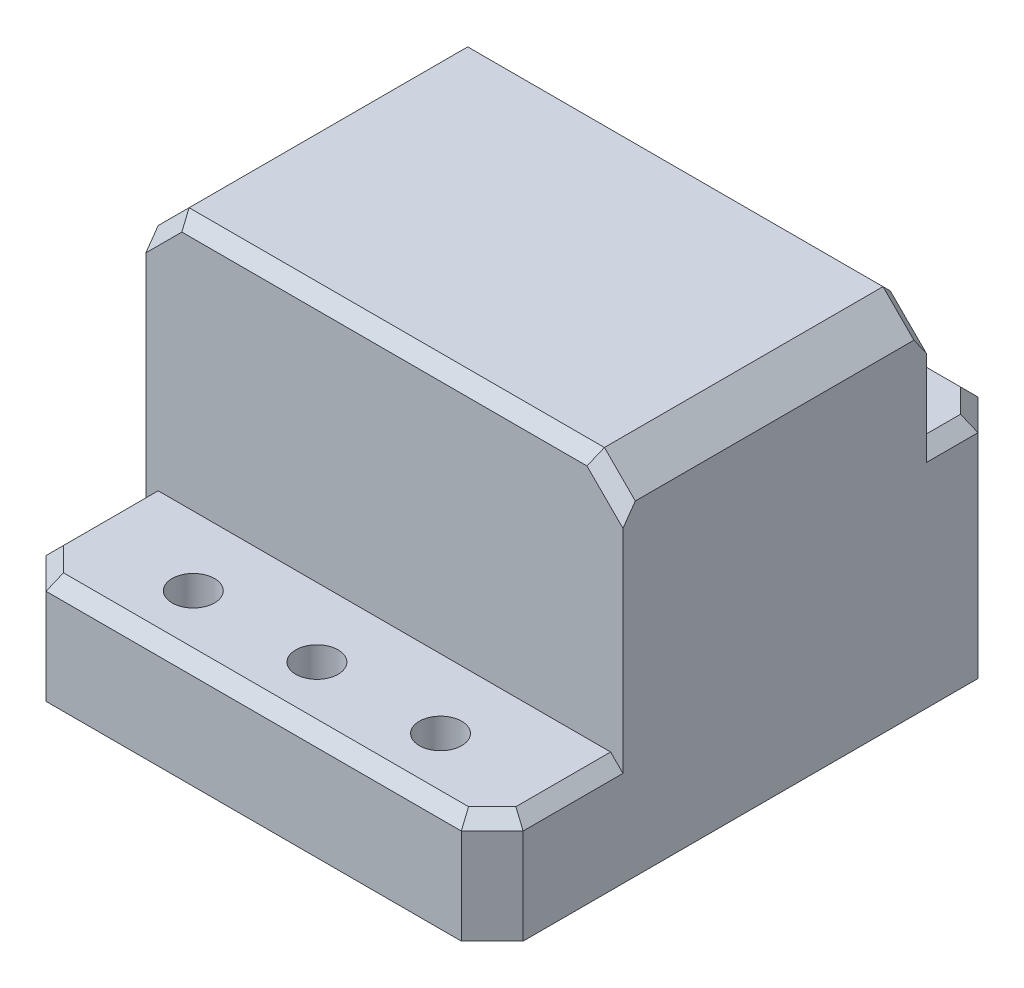
from build123d import *

# Parameters (mm, degrees)
BOSS_EXTRUDE1_DEPTH = 49.022
CHAMFER4_SIZE       = 3.175
CHAMFER5_SIZE       = 3.175
CHAMFER6_SIZE       = 3.175
SKETCH4_R           = 2.178410544
CUT_EXTRUDE1_DEPTH  = 5.08
CHAMFER7_SIZE       = 1.27
CHAMFER8_SIZE       = 1.27
CHAMFER9_SIZE       = 1.27


with BuildPart() as part:
    # Sketch1 → Boss-Extrude1 (new body)
    with BuildSketch(Plane(origin=(0, 0, 0), x_dir=(0, 0, -1), z_dir=(1, 0, 0))):
        Polygon((19.343076923, 8.689730769), (27.832538462, 8.689730769), (27.832538462, -14.453576923), (-25.253461538, -14.453576923), (-25.253461538, -3.385038462), (-11.820769231, -3.385038462), (-11.820769231, 22.122423077), (19.343076923, 22.122423077), align=None)
    extrude(amount=BOSS_EXTRUDE1_DEPTH)

    # Chamfer4
    chamfer4_edges = [part.edges().sort_by_distance(p)[0] for p in [
        (0, 22.122423077, -3.761153846),
    ]]
    chamfer(chamfer4_edges, length=CHAMFER4_SIZE)

    # Chamfer5
    chamfer5_edges = [part.edges().sort_by_distance(p)[0] for p in [
        (49.022, 22.122423077, -3.761153846),
    ]]
    chamfer(chamfer5_edges, length=CHAMFER5_SIZE)

    # Chamfer6
    chamfer6_edges = [part.edges().sort_by_distance(p)[0] for p in [
        (49.022, -2.881923077, -27.832538462),
        (49.022, -8.919307692, 25.253461538),
        (0, -8.919307692, 25.253461538),
        (0, -2.881923077, -27.832538462),
    ]]
    chamfer(chamfer6_edges, length=CHAMFER6_SIZE)

    # Sketch4 → Cut-Extrude1 (cut)
    with BuildSketch(Plane(origin=(0, -3.385038462, 0), x_dir=(1, 0, 0), z_dir=(0, 1, 0))):
        with Locations((24.66531327, -18.90809717)):
            Circle(SKETCH4_R)
        with Locations((37.36531327, -18.90809717)):
            Circle(SKETCH4_R)
        with Locations((11.96531327, -18.90809717)):
            Circle(SKETCH4_R)
    extrude(amount=-CUT_EXTRUDE1_DEPTH, mode=Mode.SUBTRACT)

    # Chamfer7
    chamfer7_edges = [part.edges().sort_by_distance(p)[0] for p in [
        (49.022, 8.689730769, -22.000307692),
        (47.4345, 8.689730769, -26.245038462),
        (24.511, 8.689730769, -27.832538462),
        (1.5875, 8.689730769, -26.245038462),
        (0, 8.689730769, -22.000307692),
    ]]
    chamfer(chamfer7_edges, length=CHAMFER7_SIZE)

    # Chamfer8
    chamfer8_edges = [part.edges().sort_by_distance(p)[0] for p in [
        (49.022, -3.385038462, 16.949615385),
        (47.4345, -3.385038462, 23.665961538),
        (24.511, -3.385038462, 25.253461538),
        (1.5875, -3.385038462, 23.665961538),
        (0, -3.385038462, 16.949615385),
    ]]
    chamfer(chamfer8_edges, length=CHAMFER8_SIZE)

    # Chamfer9
    chamfer9_edges = [part.edges().sort_by_distance(p)[0] for p in [
        (1.5875, 20.534923077, -19.343076923),
        (24.511, 22.122423077, -19.343076923),
        (47.4345, 20.534923077, -19.343076923),
        (47.4345, 20.534923077, 11.820769231),
        (24.511, 22.122423077, 11.820769231),
        (1.5875, 20.534923077, 11.820769231),
    ]]
    chamfer(chamfer9_edges, length=CHAMFER9_SIZE)


solid = part.part
